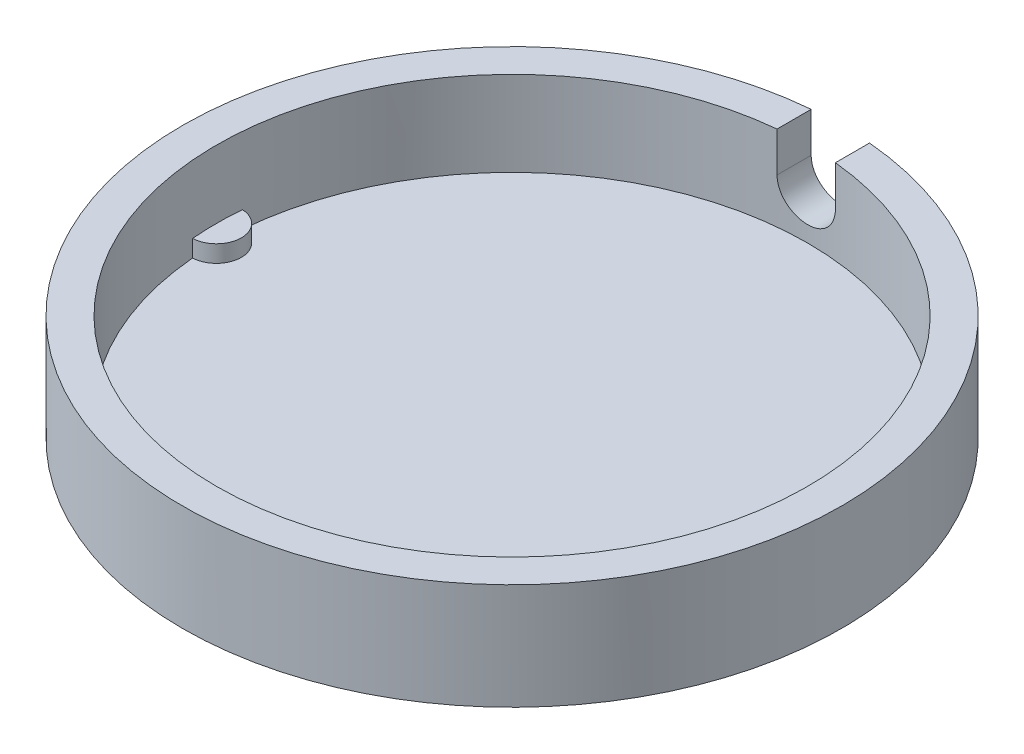
from build123d import *

# Parameters (mm, degrees)
SKETCH1_R           = 31.06
BOSS_EXTRUDE1_DEPTH = 10
SKETCH2_R           = 27.86
CUT_EXTRUDE1_DEPTH  = 8
BOSS_EXTRUDE2_START = 1.6
BOSS_EXTRUDE2_DEPTH = 1.6
CUT_EXTRUDE2_DEPTH  = 46.049386233


with BuildPart() as part:
    # Sketch1 → Boss-Extrude1 (new body)
    with BuildSketch(Plane(origin=(0, 0, 0), x_dir=(1, 0, 0), z_dir=(0, 1, 0))):
        Circle(SKETCH1_R)
    extrude(amount=BOSS_EXTRUDE1_DEPTH)

    # Sketch2 → Cut-Extrude1 (cut)
    with BuildSketch(Plane(origin=(0, 10, 0), x_dir=(1, 0, 0), z_dir=(0, 1, 0))):
        Circle(SKETCH2_R)
    extrude(amount=-CUT_EXTRUDE1_DEPTH, mode=Mode.SUBTRACT)

    # Sketch3 → Boss-Extrude2 (add)
    with BuildSketch(Plane(origin=(0, 2, 0), x_dir=(1, 0, 0), z_dir=(0, 1, 0)).offset(BOSS_EXTRUDE2_START)):
        with BuildLine():
            ThreePointArc((-27.76088837, -2.347909045), (-25.51, 0), (-27.76088837, 2.347909045))
            ThreePointArc((-27.76088837, 2.347909045), (-27.86, 0), (-27.76088837, -2.347909045))
        make_face()
        with BuildLine():
            ThreePointArc((27.76088837, 2.347909045), (25.51, 0), (27.76088837, -2.347909045))
            ThreePointArc((27.76088837, -2.347909045), (27.86, 0), (27.76088837, 2.347909045))
        make_face()
    extrude(amount=-BOSS_EXTRUDE2_DEPTH)

    # Sketch4 → Cut-Extrude2 (cut, through all)
    with BuildSketch(Plane.XY):
        with BuildLine():
            Line((2.75, 6.25), (2.75, 10))
            Line((2.75, 10), (-2.75, 10))
            Line((-2.75, 10), (-2.75, 6.25))
            ThreePointArc((-2.75, 6.25), (-1.944543648, 4.305456352), (0, 3.5))
            ThreePointArc((0, 3.5), (1.944543648, 4.305456352), (2.75, 6.25))
        make_face()
    extrude(amount=-CUT_EXTRUDE2_DEPTH, mode=Mode.SUBTRACT)


solid = part.part
